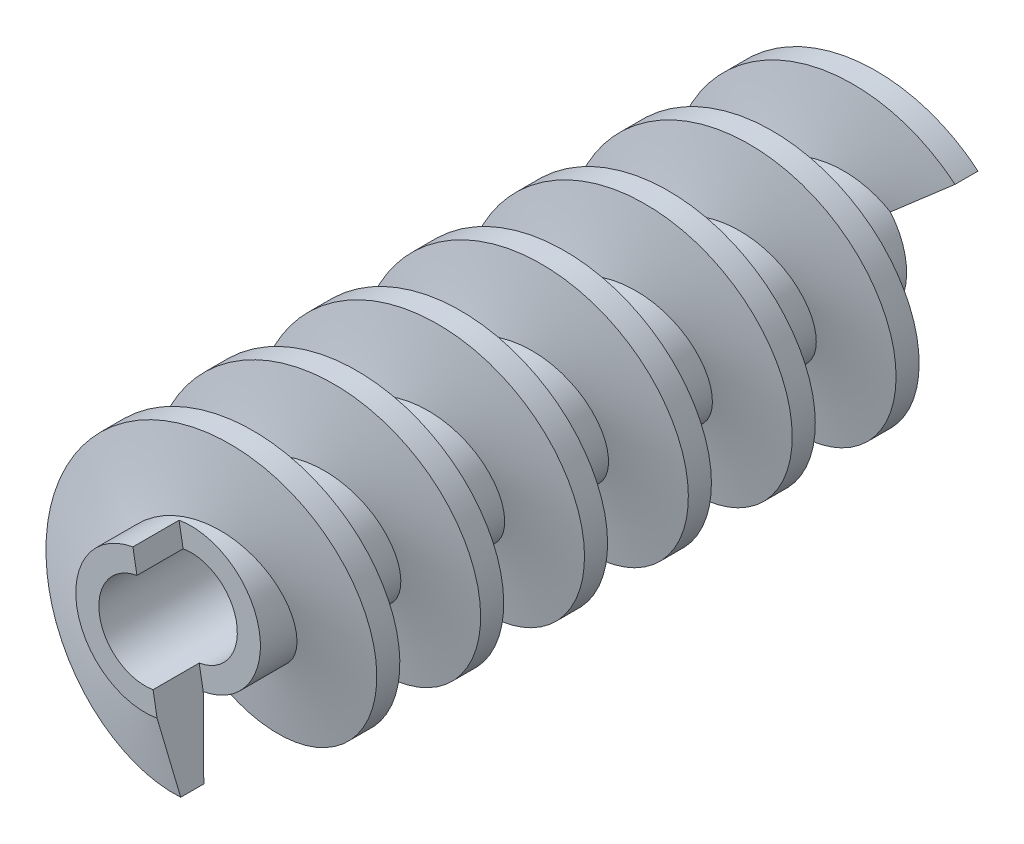
from build123d import *

# Parameters (mm, degrees)
SKETCH_1_R          = 3
SKETCH_1_R_2        = 2
EXTRUDE_1_DEPTH     = 32
SWEEP_1_PITCH       = 4.5
SKETCH_14_R         = 7
CUT_EXTRUDE_6_DEPTH = 5
CUT_EXTRUDE_7_DEPTH = 2
SKETCH_16_R         = 7
CUT_EXTRUDE_8_DEPTH = 2
CUT_EXTRUDE_9_DEPTH = 2


with BuildPart() as part:
    # 草图1 → 凸台-拉伸1 (new body)
    with BuildSketch(Plane.XY):
        Circle(SKETCH_1_R)
        Circle(SKETCH_1_R_2, mode=Mode.SUBTRACT)
    extrude(amount=-EXTRUDE_1_DEPTH)

    # 扫描1: the profile of 草图4 profile screwed along a right-hand helix of 7 turns, 12 arcs to a turn; built about Z, then put on its axis
    sweep_1_z = Axis((0, 0, 0), (0, 0, 1))
    sweep_1_corners = [(2.9997, 0, 1.00005), (2.9997, 0, -1.00005), (6, 0, -0.5), (6, 0, 0.5)]
    with BuildLine(mode=Mode.PRIVATE) as sweep_1_profile:
        Line(sweep_1_corners[0], sweep_1_corners[1])
        Line(sweep_1_corners[1], sweep_1_corners[2])
        Line(sweep_1_corners[2], sweep_1_corners[3])
        Line(sweep_1_corners[3], sweep_1_corners[0])
    sweep_1_cap = Face(sweep_1_profile.wire())
    sweep_1_turn_angles = [0, 15, 30, 45, 60, 75, 90, 105, 120, 135, 150, 165, 180, 195, 210, 225, 240, 255, 270, 285, 300, 315, 330, 345, 360]
    sweep_1_turn_weights = [1, 0.9659258262890683, 1, 0.9659258262890683, 1, 0.9659258262890683, 1, 0.9659258262890683, 1, 0.9659258262890683, 1, 0.9659258262890683, 1, 0.9659258262890683, 1, 0.9659258262890683, 1, 0.9659258262890683, 1, 0.9659258262890683, 1, 0.9659258262890683, 1, 0.9659258262890683, 1]
    sweep_1_turn_rails = [Edge.make_bspline([Vector(p[0], p[1], 0).rotate(sweep_1_z, sweep_1_turn_angles[k]) / sweep_1_turn_weights[k] + Vector(0, 0, p[2] + SWEEP_1_PITCH * sweep_1_turn_angles[k] / 360) for k in range(25)], [0, 0, 0, 1, 1, 2, 2, 3, 3, 4, 4, 5, 5, 6, 6, 7, 7, 8, 8, 9, 9, 10, 10, 11, 11, 12, 12, 12], 2, sweep_1_turn_weights) for p in sweep_1_corners]
    sweep_1_turn_sides = [Face.make_surface_from_curves(sweep_1_turn_rails[p[0]], sweep_1_turn_rails[p[1]]) for p in [(0, 1), (1, 2), (2, 3), (3, 0)]]
    sweep_1 = Plane(origin=(0, 0, 0), x_dir=(1, 0, 0), z_dir=(0, 0, -1)) * Solid(Shell([*[p.moved(Location((0, 0, SWEEP_1_PITCH * i))) for i in range(7) for p in sweep_1_turn_sides], sweep_1_cap, sweep_1_cap.rotate(sweep_1_z, 2520).moved(Location((0, 0, SWEEP_1_PITCH * 2520 / 360)))]))
    add(sweep_1)

    # 草图14 → 切除-拉伸6 (cut)
    with BuildSketch(Plane.XY):
        Circle(SKETCH_14_R)
    extrude(amount=CUT_EXTRUDE_6_DEPTH, mode=Mode.SUBTRACT)

    # 草图15 → 切除-拉伸7 (cut)
    with BuildSketch(Plane.XY):
        with BuildLine():
            Line((0, 0), (0.52356214, -2.953960508))
            Line((0.52356214, -2.953960508), (1.221644994, -6.89257452))
            ThreePointArc((1.221644994, -6.89257452), (6.89257452, 1.221644994), (-1.221644994, 6.89257452))
            Line((-1.221644994, 6.89257452), (0, 0))
        make_face()
    extrude(amount=-CUT_EXTRUDE_7_DEPTH, mode=Mode.SUBTRACT)

    # 草图16 → 切除-拉伸8 (cut)
    with BuildSketch(Plane(origin=(0, 0, -32), x_dir=(-1, 0, 0), z_dir=(0, 0, -1))):
        Circle(SKETCH_16_R)
    extrude(amount=CUT_EXTRUDE_8_DEPTH, mode=Mode.SUBTRACT)

    # 草图17 → 切除-拉伸9 (cut)
    with BuildSketch(Plane(origin=(0, 0, -32), x_dir=(-1, 0, 0), z_dir=(0, 0, -1))):
        with BuildLine():
            Line((0, 0), (-2.296423772, 1.930398368))
            Line((-2.296423772, 1.930398368), (-5.358322134, 4.504262859))
            ThreePointArc((-5.358322134, 4.504262859), (-4.504262859, -5.358322134), (5.358322134, -4.504262859))
            Line((5.358322134, -4.504262859), (0, 0))
        make_face()
    extrude(amount=-CUT_EXTRUDE_9_DEPTH, mode=Mode.SUBTRACT)


solid = part.part
